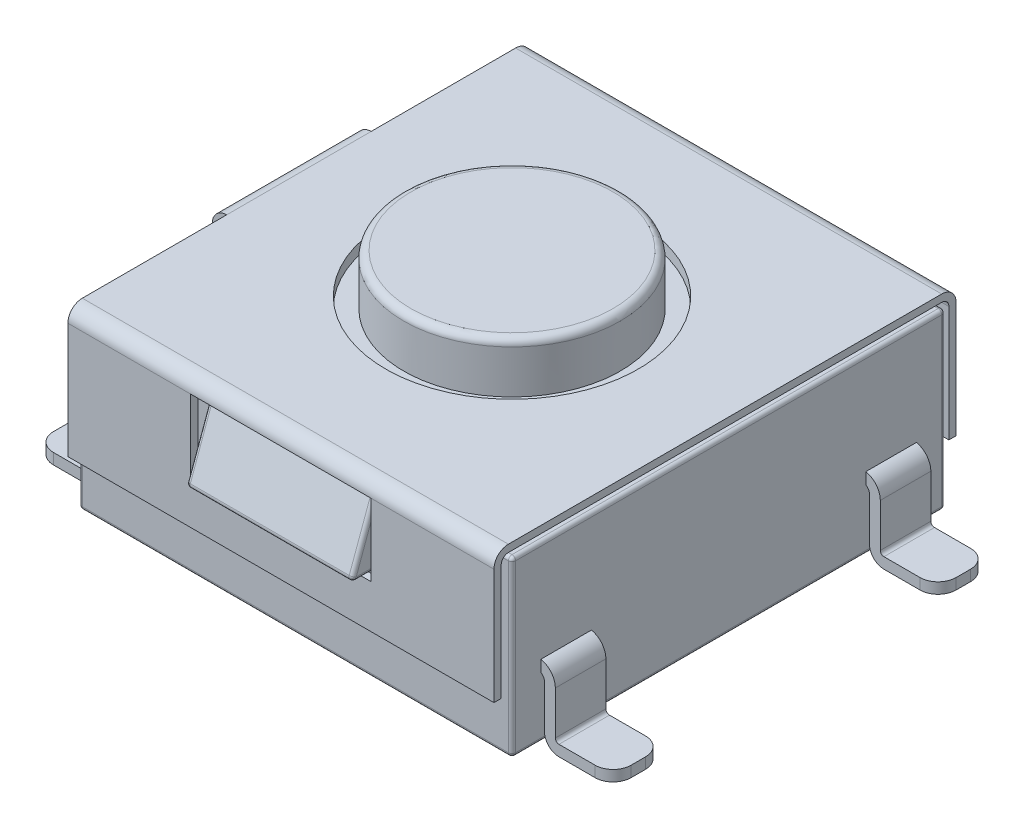
from build123d import *

# Parameters (mm, degrees)
SKETCH1_W                       = 6
SKETCH1_H                       = 6
BOSS_EXTRUDE1_DEPTH             = 2.4
BOSS_EXTRUDE2_DEPTH             = 3
SKETCH3_R                       = 1.75
CUT_EXTRUDE1_DEPTH              = 0.1
SKETCH12_R                      = 1.85
SKETCH12_R_2                    = 1.75
BOSS_EXTRUDE7_DEPTH             = 0.15
SKETCH4_R                       = 1.5
BOSS_EXTRUDE3_DEPTH             = 0.7
FILLET1_R                       = 0.1
CUT_EXTRUDE4_DEPTH              = 8.849203781
CUT_EXTRUDE3_DEPTH              = 2
CUT_EXTRUDE2_DEPTH              = 8.430511423
BOSS_EXTRUDE6_DEPTH             = 0.35
FILLET2_R                       = 0.25
FILLET2_OF_MIRROR1_R            = 0.25
BOSS_EXTRUDE4_REACH             = 7.883
BOSS_EXTRUDE4_DIRECTION_2_REACH = 7.883
SKETCH9_W                       = 2.5
SKETCH9_H                       = 1
CUT_EXTRUDE5_DEPTH              = 0.1
BOSS_EXTRUDE5_DEPTH             = 1.15
FILLET4_R                       = 0.05
FILLET5_R                       = 0.05


with BuildPart() as part:
    # Sketch1 → Boss-Extrude1 (new body)
    with BuildSketch(Plane(origin=(0, 0, 0), x_dir=(1, 0, 0), z_dir=(0, 1, 0))):
        Rectangle(SKETCH1_W, SKETCH1_H)
    extrude(amount=BOSS_EXTRUDE1_DEPTH)



with BuildPart() as body_2:
    # Sketch2 → Boss-Extrude2 (new, symmetric)
    with BuildSketch(Plane.XY):
        with BuildLine():
            Line((-4, -0.05), (-3.25, -0.05))
            ThreePointArc((-3.25, -0.05), (-3.108578644, 0.008578644), (-3.05, 0.15))
            Line((-3.05, 0.15), (-3.05, 2.35))
            ThreePointArc((-3.05, 2.35), (-3.020710678, 2.420710678), (-2.95, 2.45))
            Line((-2.95, 2.45), (2.95, 2.45))
            ThreePointArc((2.95, 2.45), (3.020710678, 2.420710678), (3.05, 2.35))
            Line((3.05, 2.35), (3.05, 0.15))
            ThreePointArc((3.05, 0.15), (3.108578644, 0.008578644), (3.25, -0.05))
            Line((3.25, -0.05), (4, -0.05))
            Line((4, -0.05), (4, 0.05))
            Line((4, 0.05), (3.25, 0.05))
            ThreePointArc((3.25, 0.05), (3.179289322, 0.079289322), (3.15, 0.15))
            Line((3.15, 0.15), (3.15, 2.35))
            ThreePointArc((3.15, 2.35), (3.091421356, 2.491421356), (2.95, 2.55))
            Line((2.95, 2.55), (-2.95, 2.55))
            ThreePointArc((-2.95, 2.55), (-3.091421356, 2.491421356), (-3.15, 2.35))
            Line((-3.15, 2.35), (-3.15, 0.15))
            ThreePointArc((-3.15, 0.15), (-3.179289322, 0.079289322), (-3.25, 0.05))
            Line((-3.25, 0.05), (-4, 0.05))
            Line((-4, 0.05), (-4, -0.05))
        make_face()
    extrude(amount=BOSS_EXTRUDE2_DEPTH, both=True)

    # Sketch3 → Cut-Extrude1 (cut)
    with BuildSketch(Plane(origin=(0, 2.55, 0), x_dir=(1, 0, 0), z_dir=(0, 1, 0))):
        with Locations(Location((0, 0, 0), (0, 0, 180))):
            Circle(SKETCH3_R)
    extrude(amount=-CUT_EXTRUDE1_DEPTH, mode=Mode.SUBTRACT)


with BuildPart() as part_1:
    add(part.part)

    add(body_2.part)  # Boss-Extrude7 merges body 2
    # Sketch12 → Boss-Extrude7 (add)
    with BuildSketch(Plane(origin=(0, 2.55, 0), x_dir=(1, 0, 0), z_dir=(0, 1, 0))):
        with Locations(Location((0, 0, 0), (0, 0, 270))):
            Circle(SKETCH12_R)
        with Locations(Location((0, 0, 0), (0, 0, 180))):
            Circle(SKETCH12_R_2, mode=Mode.SUBTRACT)
    extrude(amount=-BOSS_EXTRUDE7_DEPTH)

    # Sketch4 → Boss-Extrude3 (add)
    with BuildSketch(Plane(origin=(0, 2.4, 0), x_dir=(1, 0, 0), z_dir=(0, 1, 0))):
        with Locations(Location((0, 0, 0), (0, 0, 90))):
            Circle(SKETCH4_R)
    extrude(amount=BOSS_EXTRUDE3_DEPTH)

    # Fillet1
    fillet1_edges = [part_1.edges().sort_by_distance(p)[0] for p in [
        (0, 3.1, 1.5),
    ]]
    fillet(fillet1_edges, radius=FILLET1_R)

    # Sketch7 → Cut-Extrude4 (cut, through all)
    with BuildSketch(Plane.XY.offset(3)):
        with BuildLine():
            Line((2.95, 2.55), (2.95, 2.45))
            ThreePointArc((2.95, 2.45), (3.020710678, 2.420710678), (3.05, 2.35))
            Line((3.05, 2.35), (3.05, 0.15))
            ThreePointArc((3.05, 0.15), (3.108578644, 0.008578644), (3.25, -0.05))
            Line((3.25, -0.05), (4, -0.05))
            Line((4, -0.05), (4, 0.05))
            Line((4, 0.05), (3.25, 0.05))
            ThreePointArc((3.25, 0.05), (3.179289322, 0.079289322), (3.15, 0.15))
            Line((3.15, 0.15), (3.15, 2.35))
            ThreePointArc((3.15, 2.35), (3.091421356, 2.491421356), (2.95, 2.55))
        make_face()
    extrude(amount=-CUT_EXTRUDE4_DEPTH, mode=Mode.SUBTRACT)

    # Sketch6 → Cut-Extrude3 (cut)
    with BuildSketch(Plane.XY.offset(3)):
        with BuildLine():
            Line((-2.95, 2.45), (-2.95, 2.55))
            ThreePointArc((-2.95, 2.55), (-3.091421356, 2.491421356), (-3.15, 2.35))
            Line((-3.15, 2.35), (-3.15, 0.15))
            ThreePointArc((-3.15, 0.15), (-3.179289322, 0.079289322), (-3.25, 0.05))
            Line((-3.25, 0.05), (-4, 0.05))
            Line((-4, 0.05), (-4, -0.05))
            Line((-4, -0.05), (-3.25, -0.05))
            ThreePointArc((-3.25, -0.05), (-3.108578644, 0.008578644), (-3.05, 0.15))
            Line((-3.05, 0.15), (-3.05, 2.35))
            ThreePointArc((-3.05, 2.35), (-3.020710678, 2.420710678), (-2.95, 2.45))
        make_face()
    cut_extrude3 = extrude(amount=-CUT_EXTRUDE3_DEPTH, mode=Mode.SUBTRACT)

    # Sketch5 → Cut-Extrude2 (cut, through all)
    with BuildSketch(Plane(origin=(-3.05, 0, 0), x_dir=(0, 0, -1), z_dir=(1, 0, 0))):
        with BuildLine():
            Line((-0.35, -0.05), (-1, -0.05))
            Line((-1, -0.05), (-1, 0.95))
            Line((-1, 0.95), (-0.55, 0.95))
            ThreePointArc((-0.55, 0.95), (-0.408578644, 0.891421356), (-0.35, 0.75))
            Line((-0.35, 0.75), (-0.35, -0.05))
        make_face()
    cut_extrude2 = extrude(amount=-CUT_EXTRUDE2_DEPTH, mode=Mode.SUBTRACT)

    # Sketch11 → Boss-Extrude6 (add, symmetric)
    with BuildSketch(Plane.XY.offset(2.25)):
        with BuildLine():
            Line((-4, -0.05), (-3.25, -0.05))
            ThreePointArc((-3.25, -0.05), (-3.108578644, 0.008578644), (-3.05, 0.15))
            Line((-3.05, 0.15), (-3.05, 0.75))
            ThreePointArc((-3.05, 0.75), (-3.020710678, 0.820710678), (-2.95, 0.85))
            Line((-2.95, 0.85), (2.95, 0.85))
            ThreePointArc((2.95, 0.85), (3.020710678, 0.820710678), (3.05, 0.75))
            Line((3.05, 0.75), (3.05, 0.15))
            ThreePointArc((3.05, 0.15), (3.108578644, 0.008578644), (3.25, -0.05))
            Line((3.25, -0.05), (4, -0.05))
            Line((4, -0.05), (4, 0.1))
            Line((4, 0.1), (3.25, 0.1))
            ThreePointArc((3.25, 0.1), (3.214644661, 0.114644661), (3.2, 0.15))
            Line((3.2, 0.15), (3.2, 0.75))
            ThreePointArc((3.2, 0.75), (3.126776695, 0.926776695), (2.95, 1))
            Line((2.95, 1), (-2.95, 1))
            ThreePointArc((-2.95, 1), (-3.126776695, 0.926776695), (-3.2, 0.75))
            Line((-3.2, 0.75), (-3.2, 0.15))
            ThreePointArc((-3.2, 0.15), (-3.214644661, 0.114644661), (-3.25, 0.1))
            Line((-3.25, 0.1), (-4, 0.1))
            Line((-4, 0.1), (-4, -0.05))
        make_face()
    boss_extrude6 = extrude(amount=BOSS_EXTRUDE6_DEPTH, both=True)

    # Fillet2
    fillet2_edges = [part_1.edges().sort_by_distance(p)[0] for p in [
        (-3.1, 0.95, 1),
        (-4, 0, 0.35),
        (4, 0.025, 2.6),
        (-4, 0.025, 2.6),
        (-4, 0.025, 1.9),
        (4, 0.025, 1.9),
    ]]
    fillet(fillet2_edges, radius=FILLET2_R)

    # Mirror1: Cut-Extrude3, Cut-Extrude2, Boss-Extrude6 across plane
    add(cut_extrude3.mirror(Plane.XY), mode=Mode.SUBTRACT)
    add(cut_extrude2.mirror(Plane.XY), mode=Mode.SUBTRACT)
    add(boss_extrude6.mirror(Plane.XY))

    # Fillet2 of Mirror1
    fillet2_of_mirror1_edges = [part_1.edges().sort_by_distance(p)[0] for p in [
        (-3.1, 0.95, -1),
        (-4, 0, -0.35),
        (4, 0.025, -2.6),
        (-4, 0.025, -2.6),
        (-4, 0.025, -1.9),
        (4, 0.025, -1.9),
    ]]
    fillet(fillet2_of_mirror1_edges, radius=FILLET2_OF_MIRROR1_R)

    # Boss-Extrude4: up to this face of the body (flat: up to its plane)
    boss_extrude4_end = Plane(part_1.part.faces().sort_by_distance((-2.95, 2.5, -2))[0])
    # Sketch8 → Boss-Extrude4 (add, up to the picked face)
    with BuildSketch(Plane(origin=(0, 0, 0), x_dir=(0, 0, -1), z_dir=(1, 0, 0)), mode=Mode.PRIVATE) as boss_extrude4_sk1:
        with BuildLine():
            Line((3.1, 2.35), (3.1, 0.75))
            Line((3.1, 0.75), (3.2, 0.75))
            Line((3.2, 0.75), (3.2, 2.35))
            ThreePointArc((3.2, 2.35), (3.141421356, 2.491421356), (3, 2.55))
            Line((3, 2.55), (3, 2.45))
            ThreePointArc((3, 2.45), (3.070710678, 2.420710678), (3.1, 2.35))
        make_face()
    boss_extrude4_tool1 = split(extrude(boss_extrude4_sk1.sketch, amount=-BOSS_EXTRUDE4_REACH, mode=Mode.PRIVATE), bisect_by=boss_extrude4_end, keep=Keep.BOTH, mode=Mode.PRIVATE)
    # Sketch8 → Boss-Extrude4 (add, up to the picked face)
    with BuildSketch(Plane(origin=(0, 0, 0), x_dir=(0, 0, -1), z_dir=(1, 0, 0)), mode=Mode.PRIVATE) as boss_extrude4_sk2:
        with BuildLine():
            Line((-3, 2.55), (-3, 2.45))
            ThreePointArc((-3, 2.45), (-3.070710678, 2.420710678), (-3.1, 2.35))
            Line((-3.1, 2.35), (-3.1, 0.75))
            Line((-3.1, 0.75), (-3.2, 0.75))
            Line((-3.2, 0.75), (-3.2, 2.35))
            ThreePointArc((-3.2, 2.35), (-3.141421356, 2.491421356), (-3, 2.55))
        make_face()
    boss_extrude4_tool2 = split(extrude(boss_extrude4_sk2.sketch, amount=-BOSS_EXTRUDE4_REACH, mode=Mode.PRIVATE), bisect_by=boss_extrude4_end, keep=Keep.BOTH, mode=Mode.PRIVATE)
    add(boss_extrude4_tool1.solids().sort_by(Axis((0, 1.665399, -3.143457), (-1, 0, 0)))[0])
    add(boss_extrude4_tool2.solids().sort_by(Axis((0, 1.665399, 3.143457), (-1, 0, 0)))[0])

    # Boss-Extrude4 direction 2: up to this face of the body (flat: up to its plane)
    boss_extrude4_direction_2_end = Plane(part_1.part.faces().sort_by_distance((2.95, 2.5, 0))[0])
    # Sketch8 → Boss-Extrude4 direction 2 (add, up to the picked face)
    with BuildSketch(Plane(origin=(0, 0, 0), x_dir=(0, 0, -1), z_dir=(1, 0, 0)), mode=Mode.PRIVATE) as boss_extrude4_direction_2_sk1:
        with BuildLine():
            Line((3.1, 2.35), (3.1, 0.75))
            Line((3.1, 0.75), (3.2, 0.75))
            Line((3.2, 0.75), (3.2, 2.35))
            ThreePointArc((3.2, 2.35), (3.141421356, 2.491421356), (3, 2.55))
            Line((3, 2.55), (3, 2.45))
            ThreePointArc((3, 2.45), (3.070710678, 2.420710678), (3.1, 2.35))
        make_face()
    boss_extrude4_direction_2_tool1 = split(extrude(boss_extrude4_direction_2_sk1.sketch, amount=BOSS_EXTRUDE4_DIRECTION_2_REACH, mode=Mode.PRIVATE), bisect_by=boss_extrude4_direction_2_end, keep=Keep.BOTH, mode=Mode.PRIVATE)
    # Sketch8 → Boss-Extrude4 direction 2 (add, up to the picked face)
    with BuildSketch(Plane(origin=(0, 0, 0), x_dir=(0, 0, -1), z_dir=(1, 0, 0)), mode=Mode.PRIVATE) as boss_extrude4_direction_2_sk2:
        with BuildLine():
            Line((-3, 2.55), (-3, 2.45))
            ThreePointArc((-3, 2.45), (-3.070710678, 2.420710678), (-3.1, 2.35))
            Line((-3.1, 2.35), (-3.1, 0.75))
            Line((-3.1, 0.75), (-3.2, 0.75))
            Line((-3.2, 0.75), (-3.2, 2.35))
            ThreePointArc((-3.2, 2.35), (-3.141421356, 2.491421356), (-3, 2.55))
        make_face()
    boss_extrude4_direction_2_tool2 = split(extrude(boss_extrude4_direction_2_sk2.sketch, amount=BOSS_EXTRUDE4_DIRECTION_2_REACH, mode=Mode.PRIVATE), bisect_by=boss_extrude4_direction_2_end, keep=Keep.BOTH, mode=Mode.PRIVATE)
    add(boss_extrude4_direction_2_tool1.solids().sort_by(Axis((0, 1.665399, -3.143457), (1, 0, 0)))[0])
    add(boss_extrude4_direction_2_tool2.solids().sort_by(Axis((0, 1.665399, 3.143457), (1, 0, 0)))[0])

    # Sketch9 → Cut-Extrude5 (cut)
    with BuildSketch(Plane.XY.offset(3.2)):
        with Locations((0, 1.85)):
            Rectangle(SKETCH9_W, SKETCH9_H)
    cut_extrude5 = extrude(amount=-CUT_EXTRUDE5_DEPTH, mode=Mode.SUBTRACT)

    # Mirror2: Cut-Extrude5 across plane
    add(cut_extrude5.mirror(Plane.XY), mode=Mode.SUBTRACT)

    # Sketch10 → Boss-Extrude5 (add, symmetric)
    with BuildSketch(Plane(origin=(0, 0, 0), x_dir=(0, 0, -1), z_dir=(1, 0, 0))):
        Polygon((3, 2.4), (3.378529044, 1.36), (3, 1.36), align=None)
        Polygon((-3, 1.36), (-3, 2.4), (-3.378529044, 1.36), align=None)
    extrude(amount=BOSS_EXTRUDE5_DEPTH, both=True)

    # Fillet4
    fillet4_edges = [part_1.edges().sort_by_distance(p)[0] for p in [
        (0, 1.36, 3.378529044),
        (0, 1.36, -3.378529044),
        (-3, 1.2, 3),
        (-3, 2.4, 0),
        (3, 1.2, -3),
        (3, 2.4, 0),
        (3, 1.2, 3),
        (3, 0, 0),
        (0, 0, 3),
        (-3, 0, 0),
        (0, 0, -3),
        (-3, 1.2, -3),
        (-1.15, 1.88, -3.189264522),
        (-1.15, 1.36, -3.189264522),
        (1.15, 1.88, -3.189264522),
        (1.15, 1.36, -3.189264522),
        (-1.15, 1.88, 3.189264522),
        (-1.15, 1.36, 3.189264522),
        (1.15, 1.36, 3.189264522),
        (1.15, 1.88, 3.189264522),
    ]]
    fillet(fillet4_edges, radius=FILLET4_R)

    # Fillet5
    # the kernel refuses this fillet: 0.05 mm, written as the material it takes off along each edge
    with BuildSketch(Plane(origin=(-2.95, 2.35, -2.95), x_dir=(0, 0, -1), z_dir=(0, 1, 0))) as fillet5_piece_1_section:
        Polygon((0, 0), (FILLET5_R * 1.02, 0), (FILLET5_R * 1.02, FILLET5_R * 1.02), (0, FILLET5_R * 1.02), align=None)
    fillet5_piece_1 = extrude(amount=FILLET5_R * 1.02, mode=Mode.PRIVATE)
    fillet5_piece_1 = fillet5_piece_1 - Plane(origin=(-2.95, 2.35, -2.95), x_dir=(0.7071067811865475, 0, 0.7071067811865475), z_dir=(0, 1, 0)) * Sphere(FILLET5_R, mode=Mode.PRIVATE)
    add(fillet5_piece_1, mode=Mode.SUBTRACT)
    with BuildSketch(Plane(origin=(2.95, 2.35, -2.95), x_dir=(0, 0, -1), z_dir=(0, 1, 0))) as fillet5_piece_2_section:
        Polygon((0, 0), (FILLET5_R * 1.02, 0), (FILLET5_R * 1.02, -FILLET5_R * 1.02), (0, -FILLET5_R * 1.02), align=None)
    fillet5_piece_2 = extrude(amount=FILLET5_R * 1.02, mode=Mode.PRIVATE)
    fillet5_piece_2 = fillet5_piece_2 - Plane(origin=(2.95, 2.35, -2.95), x_dir=(-0.7071067811865475, 0, 0.7071067811865475), z_dir=(0, 1, 0)) * Sphere(FILLET5_R, mode=Mode.PRIVATE)
    add(fillet5_piece_2, mode=Mode.SUBTRACT)
    with BuildSketch(Plane(origin=(2.95, 2.35, 2.95), x_dir=(0, 0, 1), z_dir=(0, 1, 0))) as fillet5_piece_3_section:
        Polygon((0, 0), (FILLET5_R * 1.02, 0), (FILLET5_R * 1.02, FILLET5_R * 1.02), (0, FILLET5_R * 1.02), align=None)
    fillet5_piece_3 = extrude(amount=FILLET5_R * 1.02, mode=Mode.PRIVATE)
    fillet5_piece_3 = fillet5_piece_3 - Plane(origin=(2.95, 2.35, 2.95), x_dir=(-0.7071067811865475, 0, -0.7071067811865475), z_dir=(0, 1, 0)) * Sphere(FILLET5_R, mode=Mode.PRIVATE)
    add(fillet5_piece_3, mode=Mode.SUBTRACT)
    with BuildSketch(Plane(origin=(-2.95, 2.35, 2.95), x_dir=(0, 0, 1), z_dir=(0, 1, 0))) as fillet5_piece_4_section:
        Polygon((0, 0), (FILLET5_R * 1.02, 0), (FILLET5_R * 1.02, -FILLET5_R * 1.02), (0, -FILLET5_R * 1.02), align=None)
    fillet5_piece_4 = extrude(amount=FILLET5_R * 1.02, mode=Mode.PRIVATE)
    fillet5_piece_4 = fillet5_piece_4 - Plane(origin=(-2.95, 2.35, 2.95), x_dir=(0.7071067811865475, 0, -0.7071067811865475), z_dir=(0, 1, 0)) * Sphere(FILLET5_R, mode=Mode.PRIVATE)
    add(fillet5_piece_4, mode=Mode.SUBTRACT)
    with BuildSketch(Plane(origin=(-1.1, 2.4, -3), x_dir=(0, 0, 1), z_dir=(-1, 0, 0))) as fillet5_piece_5_section:
        with BuildLine():
            CenterArc((FILLET5_R, -FILLET5_R), FILLET5_R, 90, 90)
            Line((0, -FILLET5_R), (0, 0))
            Line((0, 0), (FILLET5_R, 0))
        make_face()
    fillet5_piece_5 = extrude(amount=1.85, mode=Mode.PRIVATE)
    fillet5_piece_5 = fillet5_piece_5 - Plane(origin=(-1.1, 2.376621039, -2.955300357), x_dir=(0, 0.3420201433256634, -0.9396926207859103), z_dir=(0, -0.9396926207859103, -0.3420201433256634)) * Cylinder(0.05, 4, mode=Mode.PRIVATE)
    add(fillet5_piece_5, mode=Mode.SUBTRACT)
    with BuildSketch(Plane(origin=(2.95, 2.4, -3), x_dir=(0, 0, 1), z_dir=(-1, 0, 0))) as fillet5_piece_6_section:
        with BuildLine():
            CenterArc((FILLET5_R, -FILLET5_R), FILLET5_R, 90, 90)
            Line((0, -FILLET5_R), (0, 0))
            Line((0, 0), (FILLET5_R, 0))
        make_face()
    fillet5_piece_6 = extrude(amount=1.85, mode=Mode.PRIVATE)
    fillet5_piece_6 = fillet5_piece_6 - Plane(origin=(1.1, 2.387584912, -2.951309834), x_dir=(0, 0.3420201433256634, -0.9396926207859103), z_dir=(0, -0.9396926207859103, -0.3420201433256634)) * Cylinder(0.05, 4, mode=Mode.PRIVATE)
    add(fillet5_piece_6, mode=Mode.SUBTRACT)
    with BuildSketch(Plane(origin=(-2.95, 2.4, 3), x_dir=(0, 0, -1), z_dir=(1, 0, 0))) as fillet5_piece_7_section:
        with BuildLine():
            CenterArc((FILLET5_R, -FILLET5_R), FILLET5_R, 90, 90)
            Line((0, -FILLET5_R), (0, 0))
            Line((0, 0), (FILLET5_R, 0))
        make_face()
    fillet5_piece_7 = extrude(amount=1.85, mode=Mode.PRIVATE)
    fillet5_piece_7 = fillet5_piece_7 - Plane(origin=(-1.1, 2.387584912, 2.951309834), x_dir=(0, 0.3420201433256634, 0.9396926207859103), z_dir=(0, -0.9396926207859103, 0.3420201433256634)) * Cylinder(0.05, 4, mode=Mode.PRIVATE)
    add(fillet5_piece_7, mode=Mode.SUBTRACT)
    with BuildSketch(Plane(origin=(1.1, 2.4, 3), x_dir=(0, 0, -1), z_dir=(1, 0, 0))) as fillet5_piece_8_section:
        with BuildLine():
            CenterArc((FILLET5_R, -FILLET5_R), FILLET5_R, 90, 90)
            Line((0, -FILLET5_R), (0, 0))
            Line((0, 0), (FILLET5_R, 0))
        make_face()
    fillet5_piece_8 = extrude(amount=1.85, mode=Mode.PRIVATE)
    fillet5_piece_8 = fillet5_piece_8 - Plane(origin=(1.1, 2.376620614, 2.955300512), x_dir=(0, 0.3420201433256634, 0.9396926207859103), z_dir=(0, -0.9396926207859103, 0.3420201433256634)) * Cylinder(0.05, 4, mode=Mode.PRIVATE)
    add(fillet5_piece_8, mode=Mode.SUBTRACT)


solid = part_1.part
